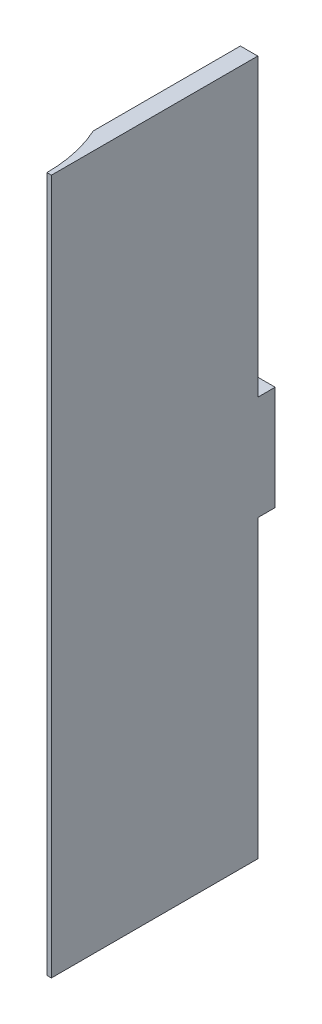
from build123d import *
from OCP.BRepAlgoAPI import BRepAlgoAPI_Cut
from OCP.TopTools import TopTools_ListOfShape

# Parameters (mm, degrees)
SKETCH2_W           = 25.4
SKETCH2_H           = 63.5
BOSS_EXTRUDE1_DEPTH = 1.5875
SKETCH3_W           = 1.5875
SKETCH3_H           = 9.525
BOSS_EXTRUDE2_DEPTH = 1.5875
SKETCH3_4_W         = 1.5875
SKETCH3_4_H         = 9.525
CUT_EXTRUDE1_DEPTH  = 3.175
CUT_EXTRUDE2_DEPTH  = 35.85276621
CAVITY1_START       = -31.74999873
CAVITY1_DEPTH       = 63.499999998


with BuildPart() as part:
    # Sketch2 → Boss-Extrude1 (new body)
    with BuildSketch(Plane(origin=(0, 0, 0), x_dir=(0, 0, -1), z_dir=(1, 0, 0))):
        Rectangle(SKETCH2_W, SKETCH2_H)
    extrude(amount=BOSS_EXTRUDE1_DEPTH)

    # Sketch3 → Boss-Extrude2 (add)
    with BuildSketch(Plane(origin=(1.5875, 0, 0), x_dir=(0, 0, -1), z_dir=(1, 0, 0))):
        with Locations((13.49375, 0)):
            Rectangle(SKETCH3_W, SKETCH3_H)
    extrude(amount=-BOSS_EXTRUDE2_DEPTH)

    # Sketch3<4> → Cut-Extrude1 (cut)
    with BuildSketch(Plane(origin=(1.5875, 0, 0), x_dir=(0, 0, -1), z_dir=(1, 0, 0))):
        with Locations((-11.90625, 0)):
            Rectangle(SKETCH3_4_W, SKETCH3_4_H)
    extrude(amount=-CUT_EXTRUDE1_DEPTH, mode=Mode.SUBTRACT)

    # Sketch4 → Cut-Extrude2 (cut, through all)
    with BuildSketch(Plane(origin=(1.5875, 0, 0), x_dir=(0, 0, -1), z_dir=(1, 0, 0))):
        Polygon((-6.14934, 31.75), (-6.14934, -31.75), (-12.7, -31.75), (-12.7, -4.7625), (-11.1125, -4.7625), (-11.1125, 4.7625), (-12.7, 4.7625), (-12.7, 31.75), align=None)
    extrude(amount=-CUT_EXTRUDE2_DEPTH, mode=Mode.SUBTRACT)


with BuildPart() as cavity1_tool:
    # Cavity1: read off the stored shape, not the designer's step
    # Cavity1 outline → Cavity1 (new body)
    with BuildSketch(Plane(origin=(0, 0, 0), x_dir=(0.9999999999641164, -8.471563968881495e-06, 0), z_dir=(8.471563968881494e-06, 0.9999999999641164, 0)).offset(CAVITY1_START)):
        with BuildLine():
            Line((-2, -6.14934), (1.17475, -6.14934))
            ThreePointArc((1.17475, -6.14934), (0.877620674, -3.377118582), (-0.000268972, -0.730836814))
            Line((-0.000268972, -0.730836814), (-0.787986067, 1))
            Line((-0.787986067, 1), (-2, 1))
            Line((-2, 1), (-2, -6.14934))
        make_face()
    extrude(amount=CAVITY1_DEPTH)


with BuildPart() as part_1:
    add(part.part)

    # Cavity1: cut by cavity1_tool, with a tolerance
    cavity1_stock = TopTools_ListOfShape()
    cavity1_stock.Append(part_1.part.wrapped)
    cavity1_tools = TopTools_ListOfShape()
    cavity1_tools.Append(cavity1_tool.part.wrapped)
    cavity1_cut = BRepAlgoAPI_Cut()
    cavity1_cut.SetArguments(cavity1_stock)
    cavity1_cut.SetTools(cavity1_tools)
    cavity1_cut.SetFuzzyValue(0.00001)
    cavity1_cut.Build()
    add(Compound.cast(cavity1_cut.Shape()).solids(), mode=Mode.REPLACE)


solid = part_1.part
